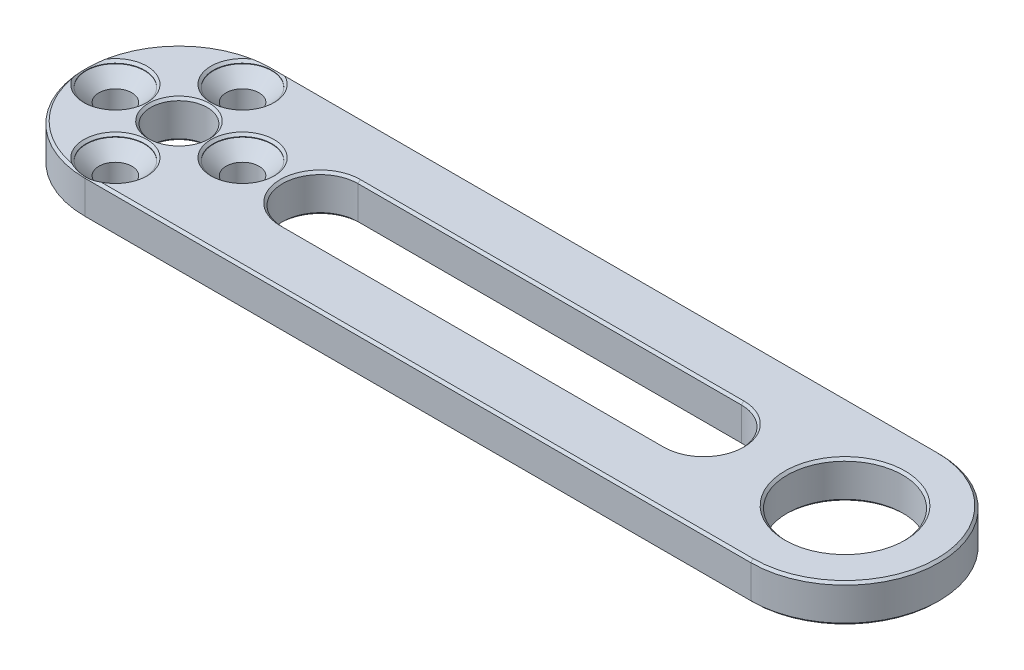
from build123d import *

# Parameters (mm, degrees)
SKETCH1_R                                      = 1.75
SKETCH1_R_2                                    = 3
SKETCH1_R_3                                    = 6.125
BOSS_EXTRUDE1_DEPTH                            = 2
CSK_FOR_M3_FLAT_HEAD_MACHINE_SCREW2_AT_2_COUNT = 2
CSK_FOR_M3_FLAT_HEAD_MACHINE_SCREW2_AT_2_PITCH = 9.545941546
CSK_FOR_M3_FLAT_HEAD_MACHINE_SCREW2_AT_3_COUNT = 2
CSK_FOR_M3_FLAT_HEAD_MACHINE_SCREW2_AT_3_PITCH = 13.5
CSK_FOR_M3_FLAT_HEAD_MACHINE_SCREW2_AT_4_COUNT = 2
CSK_FOR_M3_FLAT_HEAD_MACHINE_SCREW2_AT_4_PITCH = 9.545941546
CHAMFER1_SIZE                                  = 0.25


with BuildPart() as part:
    # Sketch1 → Boss-Extrude1 (new, symmetric)
    with BuildSketch(Plane(origin=(0, 0, 0), x_dir=(1, 0, 0), z_dir=(0, 1, 0))):
        with BuildLine():
            Line((0, 10), (70.71, 10))
            ThreePointArc((70.71, 10), (80.71, 0), (70.71, -10))
            Line((70.71, -10), (0, -10))
            ThreePointArc((0, -10), (-10, 0), (0, 10))
        make_face()
        with Locations(Location((0, 6.75, 0), (0, 0, 270))):
            Circle(SKETCH1_R, mode=Mode.SUBTRACT)
        with Locations(Location((6.75, 0, 0), (0, 0, 270))):
            Circle(SKETCH1_R, mode=Mode.SUBTRACT)
        with Locations(Location((0, -6.75, 0), (0, 0, 270))):
            Circle(SKETCH1_R, mode=Mode.SUBTRACT)
        with Locations(Location((-6.75, 0, 0), (0, 0, 270))):
            Circle(SKETCH1_R, mode=Mode.SUBTRACT)
        with Locations(Location((0, 0, 0), (0, 0, 270))):
            Circle(SKETCH1_R_2, mode=Mode.SUBTRACT)
        with Locations(Location((70.71, 0, 0), (0, 0, 270))):
            Circle(SKETCH1_R_3, mode=Mode.SUBTRACT)
        with BuildLine():
            Line((15, 4), (55.71, 4))
            ThreePointArc((55.71, 4), (59.71, 0), (55.71, -4))
            Line((55.71, -4), (15, -4))
            ThreePointArc((15, -4), (11, 0), (15, 4))
        make_face(mode=Mode.SUBTRACT)
    extrude(amount=BOSS_EXTRUDE1_DEPTH, both=True)

    # Sketch3 → CSK for M3 Flat Head Machine Screw2 (revolve, cut)
    with BuildSketch(Plane(origin=(0, 2, -6.75), x_dir=(0, 0, 1), z_dir=(1, 0, 0))):
        Polygon((0, 0), (0, 4), (1.75, 4), (1.75, 1.65), (3.1, 0.3), (3.1, 0), align=None)
    csk_for_m3_flat_head_machine_screw2 = revolve(axis=Axis((0, 8.35, -6.75), (0, -1, 0)), mode=Mode.SUBTRACT)

    # CSK for M3 Flat Head Machine Screw2 at 2: CSK for M3 Flat Head Machine Screw2 ×2
    with Locations(*[Vector(0.7071067811865476, 0, 0.7071067811865476) * (i * CSK_FOR_M3_FLAT_HEAD_MACHINE_SCREW2_AT_2_PITCH) for i in range(1, CSK_FOR_M3_FLAT_HEAD_MACHINE_SCREW2_AT_2_COUNT)]):
        add(csk_for_m3_flat_head_machine_screw2, mode=Mode.SUBTRACT)

    # CSK for M3 Flat Head Machine Screw2 at 3: CSK for M3 Flat Head Machine Screw2 ×2
    with Locations(*[(0, 0, i * CSK_FOR_M3_FLAT_HEAD_MACHINE_SCREW2_AT_3_PITCH) for i in range(1, CSK_FOR_M3_FLAT_HEAD_MACHINE_SCREW2_AT_3_COUNT)]):
        add(csk_for_m3_flat_head_machine_screw2, mode=Mode.SUBTRACT)

    # CSK for M3 Flat Head Machine Screw2 at 4: CSK for M3 Flat Head Machine Screw2 ×2
    with Locations(*[Vector(-0.7071067811865476, 0, 0.7071067811865476) * (i * CSK_FOR_M3_FLAT_HEAD_MACHINE_SCREW2_AT_4_PITCH) for i in range(1, CSK_FOR_M3_FLAT_HEAD_MACHINE_SCREW2_AT_4_COUNT)]):
        add(csk_for_m3_flat_head_machine_screw2, mode=Mode.SUBTRACT)

    # Chamfer1
    # the kernel refuses this chamfer: 0.25 mm, written as the material it takes off along each edge
    with BuildSketch(Plane(origin=(0, -2, -6.75), x_dir=(0, 0, 1), z_dir=(-1, 0, 0))) as chamfer1_piece_1:
        Polygon((1.75 + CHAMFER1_SIZE, 0), (1.75, CHAMFER1_SIZE), (1.75, 0), align=None)
    revolve(axis=Axis((0, -2, -6.75), (0, 1, 0)), mode=Mode.SUBTRACT)
    with BuildSketch(Plane(origin=(70.71, 2, 0), x_dir=(0, 0, -1), z_dir=(-1, 0, 0))) as chamfer1_piece_2:
        Polygon((10, CHAMFER1_SIZE), (10 - CHAMFER1_SIZE, 0), (10, 0), align=None)
    revolve(axis=Axis((70.71, 2, 0), (0, -1, 0)), revolution_arc=180, mode=Mode.SUBTRACT)
    with BuildSketch(Plane(origin=(6.75, -2, 0), x_dir=(0, 0, 1), z_dir=(-1, 0, 0))) as chamfer1_piece_3:
        Polygon((1.75 + CHAMFER1_SIZE, 0), (1.75, CHAMFER1_SIZE), (1.75, 0), align=None)
    revolve(axis=Axis((6.75, -2, 0), (0, 1, 0)), mode=Mode.SUBTRACT)
    with BuildSketch(Plane(origin=(0, 2, -10), x_dir=(0, -0.9996219169112968, -0.027495876610589075), z_dir=(1, 0, 0)), Plane(origin=(70.71, -2, 10), x_dir=(0, -0.02749587661058555, -0.9996219169112968), z_dir=(-1, 0, 0))) as chamfer1_piece_4:
        Polygon((CHAMFER1_SIZE * 0.999621916911, -CHAMFER1_SIZE * 0.0274958766106), (-CHAMFER1_SIZE * 0.0274958766106, -CHAMFER1_SIZE * 0.999621916911), (0, 0), align=None)
    extrude(amount=70.71, mode=Mode.SUBTRACT)
    with BuildSketch(Plane(origin=(0, -2, 6.75), x_dir=(0, 0, 1), z_dir=(-1, 0, 0))) as chamfer1_piece_5:
        Polygon((1.75 + CHAMFER1_SIZE, 0), (1.75, CHAMFER1_SIZE), (1.75, 0), align=None)
    revolve(axis=Axis((0, -2, 6.75), (0, 1, 0)), mode=Mode.SUBTRACT)
    with BuildSketch(Plane(origin=(-6.75, -2, 0), x_dir=(0, 0, 1), z_dir=(-1, 0, 0))) as chamfer1_piece_6:
        Polygon((1.75 + CHAMFER1_SIZE, 0), (1.75, CHAMFER1_SIZE), (1.75, 0), align=None)
    revolve(axis=Axis((-6.75, -2, 0), (0, 1, 0)), mode=Mode.SUBTRACT)
    with BuildSketch(Plane(origin=(0, -2, 0), x_dir=(0, 0, 1), z_dir=(-1, 0, 0))) as chamfer1_piece_7:
        Polygon((3 + CHAMFER1_SIZE, 0), (3, CHAMFER1_SIZE), (3, 0), align=None)
    revolve(axis=Axis((0, -2, 0), (0, 1, 0)), mode=Mode.SUBTRACT)
    with BuildSketch(Plane(origin=(0, 2, 0), x_dir=(0, 0, 1), z_dir=(-1, 0, 0))) as chamfer1_piece_8:
        Polygon((3 + CHAMFER1_SIZE, 0), (3, -CHAMFER1_SIZE), (3, 0), align=None)
    revolve(axis=Axis((0, 2, 0), (0, 1, 0)), mode=Mode.SUBTRACT)
    with BuildSketch(Plane(origin=(70.71, -2, 0), x_dir=(0, 0, 1), z_dir=(-1, 0, 0))) as chamfer1_piece_9:
        Polygon((6.125 + CHAMFER1_SIZE, 0), (6.125, CHAMFER1_SIZE), (6.125, 0), align=None)
    revolve(axis=Axis((70.71, -2, 0), (0, 1, 0)), mode=Mode.SUBTRACT)
    with BuildSketch(Plane(origin=(70.71, 2, 0), x_dir=(0, 0, 1), z_dir=(-1, 0, 0))) as chamfer1_piece_10:
        Polygon((6.125 + CHAMFER1_SIZE, 0), (6.125, -CHAMFER1_SIZE), (6.125, 0), align=None)
    revolve(axis=Axis((70.71, 2, 0), (0, 1, 0)), mode=Mode.SUBTRACT)
    with BuildSketch(Plane(origin=(15, -2, 0), x_dir=(0, 0, 1), z_dir=(1, 0, 0))) as chamfer1_piece_11:
        Polygon((4 + CHAMFER1_SIZE, 0), (4, -CHAMFER1_SIZE), (4, 0), align=None)
    revolve(axis=Axis((15, -2, 0), (0, -1, 0)), revolution_arc=180, mode=Mode.SUBTRACT)
    with BuildSketch(Plane(origin=(55.71, -2, 4), x_dir=(0, -0.0274958766105856, 0.9996219169112968), z_dir=(-1, 0, 0)), Plane(origin=(15, -2, -4), x_dir=(0, -0.027495876610585647, -0.9996219169112968), z_dir=(1, 0, 0))) as chamfer1_piece_12:
        Polygon((CHAMFER1_SIZE * 0.999621916911, CHAMFER1_SIZE * 0.0274958766106), (-CHAMFER1_SIZE * 0.0274958766106, CHAMFER1_SIZE * 0.999621916911), (0, 0), align=None)
    extrude(amount=40.71, mode=Mode.SUBTRACT)
    with BuildSketch(Plane(origin=(55.71, -2, 0), x_dir=(0, 0, -1), z_dir=(-1, 0, 0))) as chamfer1_piece_13:
        Polygon((4 + CHAMFER1_SIZE, 0), (4, -CHAMFER1_SIZE), (4, 0), align=None)
    revolve(axis=Axis((55.71, -2, 0), (0, -1, 0)), revolution_arc=180, mode=Mode.SUBTRACT)
    with BuildSketch(Plane(origin=(15, 2, 0), x_dir=(0, 0, 1), z_dir=(1, 0, 0))) as chamfer1_piece_14:
        Polygon((4 + CHAMFER1_SIZE, 0), (4, CHAMFER1_SIZE), (4, 0), align=None)
    revolve(axis=Axis((15, 2, 0), (0, -1, 0)), revolution_arc=180, mode=Mode.SUBTRACT)
    with BuildSketch(Plane(origin=(55.71, 2, 4), x_dir=(0, 0.0274958766105856, 0.9996219169112968), z_dir=(-1, 0, 0)), Plane(origin=(15, 2, -4), x_dir=(0, 0.027495876610585647, -0.9996219169112968), z_dir=(1, 0, 0))) as chamfer1_piece_15:
        Polygon((CHAMFER1_SIZE * 0.999621916911, -CHAMFER1_SIZE * 0.0274958766106), (-CHAMFER1_SIZE * 0.0274958766106, -CHAMFER1_SIZE * 0.999621916911), (0, 0), align=None)
    extrude(amount=40.71, mode=Mode.SUBTRACT)
    with BuildSketch(Plane(origin=(55.71, 2, 0), x_dir=(0, 0, -1), z_dir=(-1, 0, 0))) as chamfer1_piece_16:
        Polygon((4 + CHAMFER1_SIZE, 0), (4, CHAMFER1_SIZE), (4, 0), align=None)
    revolve(axis=Axis((55.71, 2, 0), (0, -1, 0)), revolution_arc=180, mode=Mode.SUBTRACT)
    with BuildSketch(Plane(origin=(0, 2, 0), x_dir=(0, 0, 1), z_dir=(1, 0, 0))) as chamfer1_piece_17:
        Polygon((10, CHAMFER1_SIZE), (10 - CHAMFER1_SIZE, 0), (10, 0), align=None)
    revolve(axis=Axis((0, 2, 0), (0, -1, 0)), revolution_arc=180, mode=Mode.SUBTRACT)
    with BuildSketch(Plane(origin=(0, -2, -10), x_dir=(0, 0.9996219169112968, -0.027495876610589075), z_dir=(1, 0, 0)), Plane(origin=(70.71, 2, 10), x_dir=(0, 0.02749587661058555, -0.9996219169112968), z_dir=(-1, 0, 0))) as chamfer1_piece_18:
        Polygon((CHAMFER1_SIZE * 0.999621916911, CHAMFER1_SIZE * 0.0274958766106), (-CHAMFER1_SIZE * 0.0274958766106, CHAMFER1_SIZE * 0.999621916911), (0, 0), align=None)
    extrude(amount=70.71, mode=Mode.SUBTRACT)
    with BuildSketch(Plane(origin=(70.71, -2, 0), x_dir=(0, 0, -1), z_dir=(-1, 0, 0))) as chamfer1_piece_19:
        Polygon((10 - CHAMFER1_SIZE, 0), (10, -CHAMFER1_SIZE), (10, 0), align=None)
    revolve(axis=Axis((70.71, -2, 0), (0, -1, 0)), revolution_arc=180, mode=Mode.SUBTRACT)
    with BuildSketch(Plane(origin=(-6.75, 2, 0), x_dir=(0, 0, 1), z_dir=(1, 0, 0))) as chamfer1_piece_20:
        Polygon((3.1 + CHAMFER1_SIZE, 0), (3.1, CHAMFER1_SIZE), (3.1, 0), align=None)
    revolve(axis=Axis((-6.75, 2, 0), (0, -1, 0)), mode=Mode.SUBTRACT)
    with BuildSketch(Plane(origin=(0, -2, 0), x_dir=(0, 0, 1), z_dir=(1, 0, 0))) as chamfer1_piece_21:
        Polygon((10, -CHAMFER1_SIZE), (10 - CHAMFER1_SIZE, 0), (10, 0), align=None)
    revolve(axis=Axis((0, -2, 0), (0, -1, 0)), revolution_arc=180, mode=Mode.SUBTRACT)
    with BuildSketch(Plane(origin=(0, 2, 6.75), x_dir=(0, 0, 1), z_dir=(1, 0, 0))) as chamfer1_piece_22:
        Polygon((3.1 + CHAMFER1_SIZE, 0), (3.1, CHAMFER1_SIZE), (3.1, 0), align=None)
    revolve(axis=Axis((0, 2, 6.75), (0, -1, 0)), mode=Mode.SUBTRACT)
    with BuildSketch(Plane(origin=(6.75, 2, 0), x_dir=(0, 0, 1), z_dir=(1, 0, 0))) as chamfer1_piece_23:
        Polygon((3.1 + CHAMFER1_SIZE, 0), (3.1, CHAMFER1_SIZE), (3.1, 0), align=None)
    revolve(axis=Axis((6.75, 2, 0), (0, -1, 0)), mode=Mode.SUBTRACT)
    with BuildSketch(Plane(origin=(0, 2, -6.75), x_dir=(0, 0, 1), z_dir=(1, 0, 0))) as chamfer1_piece_24:
        Polygon((3.1 + CHAMFER1_SIZE, 0), (3.1, CHAMFER1_SIZE), (3.1, 0), align=None)
    revolve(axis=Axis((0, 2, -6.75), (0, -1, 0)), mode=Mode.SUBTRACT)


solid = part.part
